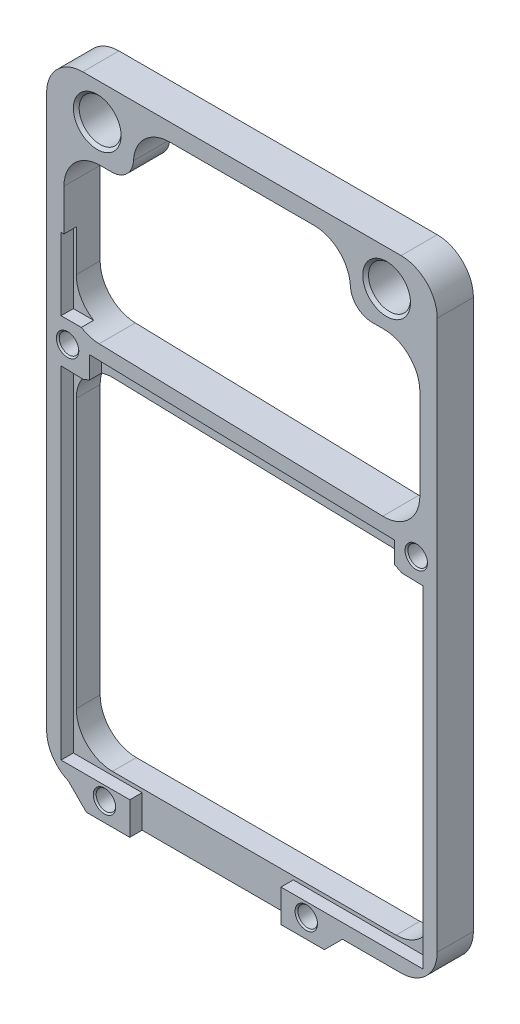
from build123d import *

# Parameters (mm, degrees)
SKETCH1_R           = 2.9
SKETCH1_R_2         = 1.35
BOSS_EXTRUDE1_DEPTH = 5
CUT_EXTRUDE1_DEPTH  = 5
CUT_EXTRUDE2_DEPTH  = 5
CHAMFER1_SIZE       = 0.4
CHAMFER2_SIZE       = 0.2
FILLET1_R           = 3
FILLET2_R           = 5
SKETCH4_W           = 20.9
SKETCH4_H           = 5
CUT_EXTRUDE3_DEPTH  = 1.7
SKETCH5_W           = 8
SKETCH5_H           = 9.98481564
CUT_EXTRUDE5_DEPTH  = 1.7
CUT_EXTRUDE6_DEPTH  = 1.7


with BuildPart() as part:
    # Sketch1 → Boss-Extrude1 (new body)
    with BuildSketch(Plane.XY):
        with BuildLine():
            Line((0, 0), (54, 0))
            Line((54, 0), (54, 83.4))
            ThreePointArc((54, 83.4), (52.535533906, 86.935533906), (49, 88.4))
            Line((49, 88.4), (5, 88.4))
            ThreePointArc((5, 88.4), (1.464466094, 86.935533906), (0, 83.4))
            Line((0, 83.4), (0, 0))
        make_face()
        with Locations((7, 83.4)):
            Circle(SKETCH1_R, mode=Mode.SUBTRACT)
        with Locations((47, 83.4)):
            Circle(SKETCH1_R, mode=Mode.SUBTRACT)
        with Locations((2.9, 54.7)):
            Circle(SKETCH1_R_2, mode=Mode.SUBTRACT)
        with Locations((51.1, 53.4)):
            Circle(SKETCH1_R_2, mode=Mode.SUBTRACT)
        with Locations((8, 2.6)):
            Circle(SKETCH1_R_2, mode=Mode.SUBTRACT)
        with Locations((35.9, 2.6)):
            Circle(SKETCH1_R_2, mode=Mode.SUBTRACT)
    extrude(amount=BOSS_EXTRUDE1_DEPTH)

    # Sketch2 → Cut-Extrude1 (cut)
    with BuildSketch(Plane.XY.offset(5)):
        Polygon((5.5, 0), (3, 2.5), (0, 2.5), (0, 0), align=None)
        Polygon((38.4, 0), (40.9, 2.5), (54, 2.5), (54, 0), align=None)
    extrude(amount=-CUT_EXTRUDE1_DEPTH, mode=Mode.SUBTRACT)

    # Sketch3 → Cut-Extrude2 (cut)
    with BuildSketch(Plane.XY.offset(5)):
        with BuildLine():
            Line((12, 81), (12, 78.4))
            Line((12, 78.4), (7.4, 78.4))
            ThreePointArc((7.4, 78.4), (3.864466094, 76.935533906), (2.4, 73.4))
            Line((2.4, 73.4), (2.4, 61.96963128))
            ThreePointArc((2.4, 61.96963128), (3.818077427, 58.48110284), (7.267932273, 56.971375773))
            Line((7.267932273, 56.971375773), (46.467932273, 55.935603416))
            ThreePointArc((46.467932273, 55.935603416), (50.088528441, 57.35193635), (51.6, 60.933858923))
            Line((51.6, 60.933858923), (51.6, 73.4))
            ThreePointArc((51.6, 73.4), (50.135533906, 76.935533906), (46.6, 78.4))
            Line((46.6, 78.4), (42, 78.4))
            Line((42, 78.4), (42, 81))
            ThreePointArc((42, 81), (40.535533906, 84.535533906), (37, 86))
            Line((37, 86), (17, 86))
            ThreePointArc((17, 86), (13.464466094, 84.535533906), (12, 81))
        make_face()
        with BuildLine():
            Line((7.532067727, 52.164396584), (46.732067727, 51.128624227))
            ThreePointArc((46.732067727, 51.128624227), (50.181922573, 49.61889716), (51.6, 46.13036872))
            Line((51.6, 46.13036872), (51.6, 10))
            ThreePointArc((51.6, 10), (50.135533906, 6.464466094), (46.6, 5))
            Line((46.6, 5), (7.4, 5))
            ThreePointArc((7.4, 5), (3.864466094, 6.464466094), (2.4, 10))
            Line((2.4, 10), (2.4, 47.166141077))
            ThreePointArc((2.4, 47.166141077), (3.911471559, 50.74806365), (7.532067727, 52.164396584))
        make_face()
    extrude(amount=-CUT_EXTRUDE2_DEPTH, mode=Mode.SUBTRACT)

    # Chamfer1
    chamfer1_edges = [part.edges().sort_by_distance(p)[0] for p in [
        (4.1, 83.4, 0),
        (4.1, 83.4, 5),
        (44.1, 83.4, 0),
        (44.1, 83.4, 5),
    ]]
    chamfer(chamfer1_edges, length=CHAMFER1_SIZE)

    # Chamfer2
    chamfer2_edges = [part.edges().sort_by_distance(p)[0] for p in [
        (1.55, 54.7, 0),
        (1.55, 54.7, 5),
        (49.75, 53.4, 0),
        (49.75, 53.4, 5),
        (6.65, 2.6, 0),
        (6.65, 2.6, 5),
        (34.55, 2.6, 0),
        (34.55, 2.6, 5),
    ]]
    chamfer(chamfer2_edges, length=CHAMFER2_SIZE)

    # Fillet1
    fillet1_edges = [part.edges().sort_by_distance(p)[0] for p in [
        (42, 78.4, 2.5),
        (12, 78.4, 2.5),
    ]]
    fillet(fillet1_edges, radius=FILLET1_R)

    # Fillet2
    # the kernel refuses this fillet: 5 mm, written as the material it takes off along each edge
    with BuildSketch(Plane(origin=(0, 2.5, 16.456439237), x_dir=(0, 1, 0), z_dir=(0, 0, -1))) as fillet2_piece_1:
        with BuildLine():
            CenterArc((4.582575695, 5), FILLET2_R, 203.578178478, 66.421821522)
            Line((0, 3), (-0.091651514, 2.96))
            ThreePointArc((-0.091651514, 2.96), (-0.1, 1.5), (-0.1, 0))
            Line((-0.1, 0), (0, -0.1))
            Line((0, -0.1), (4.582575695, -0.1))
            Line((4.582575695, -0.1), (4.582575695, 0))
        make_face()
    extrude(amount=27.912878475, mode=Mode.SUBTRACT)
    with BuildSketch(Plane(origin=(54, 2.5, 17.5), x_dir=(0, 1, 0), z_dir=(0, 0, -1))) as fillet2_piece_2:
        with BuildLine():
            CenterArc((FILLET2_R, -FILLET2_R), FILLET2_R, 90, 90)
            Line((0, -FILLET2_R), (-FILLET2_R * 0.02, -FILLET2_R))
            Line((-FILLET2_R * 0.02, -FILLET2_R), (-FILLET2_R * 0.02, FILLET2_R * 0.02))
            Line((-FILLET2_R * 0.02, FILLET2_R * 0.02), (FILLET2_R, FILLET2_R * 0.02))
            Line((FILLET2_R, FILLET2_R * 0.02), (FILLET2_R, 0))
        make_face()
    extrude(amount=30, mode=Mode.SUBTRACT)

    # Sketch4 → Cut-Extrude3 (cut)
    with BuildSketch(Plane.XY.offset(5)):
        with Locations((21.95, 2.5)):
            Rectangle(SKETCH4_W, SKETCH4_H)
    extrude(amount=-CUT_EXTRUDE3_DEPTH, mode=Mode.SUBTRACT)

    # Sketch5 → Cut-Extrude5 (cut)
    with BuildSketch(Plane.XY.offset(5)):
        Polygon((2, 51.696310663), (52, 50.375172451), (52, 4.5), (2, 4.5), align=None)
        with Locations((6, 62.69240782)):
            Rectangle(SKETCH5_W, SKETCH5_H)
    extrude(amount=-CUT_EXTRUDE5_DEPTH, mode=Mode.SUBTRACT)

    # Sketch6 → Cut-Extrude6 (cut)
    with BuildSketch(Plane.XY.offset(5)):
        Polygon((48.1, 53.891781634), (5.9, 55.006822285), (5.9, 50.553811317), (48.1, 49.438770667), align=None)
    extrude(amount=-CUT_EXTRUDE6_DEPTH, mode=Mode.SUBTRACT)


solid = part.part
